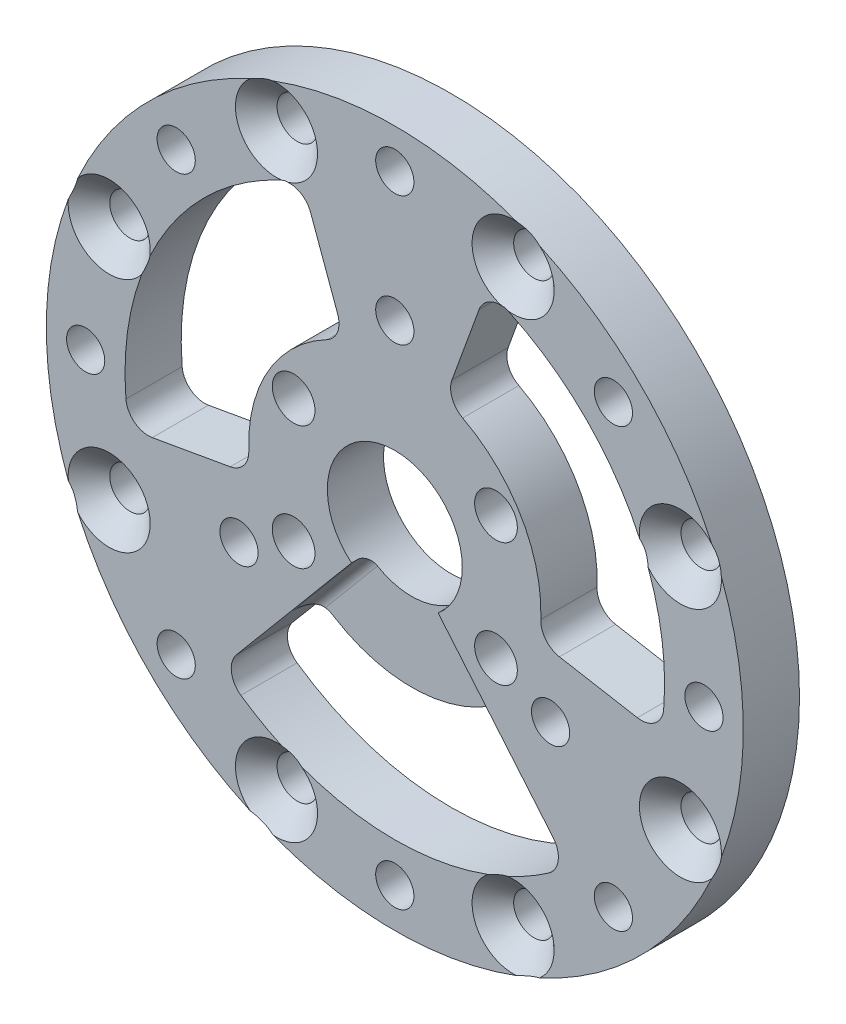
from build123d import *

# Parameters (mm, degrees)
SKETCH_1_R                     = 30.999999999999996
EXTRUDE_1_DEPTH                = 5
SKETCH_2_R                     = 6
CUT_EXTRUDE_1_DEPTH            = 45.12482294582041
HOLE_WIZARD_M3_1_D             = 3.4
HOLE_WIZARD_M3_1_2_D           = 3.6
HOLE_WIZARD_M3_1_2_CSINK_D     = 7.3
HOLE_WIZARD_M3_1_2_CSINK_ANGLE = 90
PATTERN_CIRCULAR_1_COUNT       = 8
HOLE_WIZARD_M3_2_D             = 3.4
PATTERN_CIRCULAR_2_COUNT       = 3
CUT_EXTRUDE_4_DEPTH            = 45.124823097662386
FILLET_1_R                     = 2
PATTERN_CIRCULAR_5_DEPTH       = 5
SKETCH_13_R                    = 1.9
SKETCH_13_R_2                  = 1.8999999999999984
CUT_EXTRUDE_5_DEPTH            = 45.124823097662386
CUT_EXTRUDE_6_DEPTH            = 1.5
FILLET_2_R                     = 1


# Read off the part's stored shape, not the designer's step: 円形ﾊﾟﾀｰﾝ5
with BuildPart() as part:
    # ｽｹｯﾁ1 → ﾎﾞｽ - 押し出し1 (new body)
    with BuildSketch(Plane.XY):
        Circle(SKETCH_1_R)
    extrude(amount=EXTRUDE_1_DEPTH)

    # ｽｹｯﾁ2 → ｶｯﾄ - 押し出し1 (cut, through all)
    with BuildSketch(Plane.XY.offset(5)):
        Circle(SKETCH_2_R)
    extrude(amount=-CUT_EXTRUDE_1_DEPTH, mode=Mode.SUBTRACT)

    # Hole Wizard M3 _1 (through all)
    with Locations(Plane.XY.offset(5)):
        with Locations((0, 27.5)):
            hole_wizard_m3_1 = Hole(HOLE_WIZARD_M3_1_D / 2)

    # Hole Wizard M3 _1 2 (through all)
    with Locations(Plane.XY.offset(5)):
        with Locations((10.52379439, 25.406687144)):
            hole_wizard_m3_1_2 = CounterSinkHole(HOLE_WIZARD_M3_1_2_D / 2, HOLE_WIZARD_M3_1_2_CSINK_D / 2, counter_sink_angle=HOLE_WIZARD_M3_1_2_CSINK_ANGLE)

    # 円形ﾊﾟﾀｰﾝ1: Hole Wizard M3 _1, Hole Wizard M3 _1 2 ×8 about axis
    pattern_circular_1_axis = Axis((-2.28e-14, 6.09e-15, 0), (0, 0, 1))
    add([hole_wizard_m3_1.rotate(pattern_circular_1_axis, i * 360 / PATTERN_CIRCULAR_1_COUNT) for i in range(1, PATTERN_CIRCULAR_1_COUNT)], mode=Mode.SUBTRACT)
    add([hole_wizard_m3_1_2.rotate(pattern_circular_1_axis, i * 360 / PATTERN_CIRCULAR_1_COUNT) for i in range(1, PATTERN_CIRCULAR_1_COUNT)], mode=Mode.SUBTRACT)

    # M3 すきま穴2 (through all)
    with Locations(Plane.XY.offset(5)):
        with Locations((0, 16)):
            hole_wizard_m3_2 = Hole(HOLE_WIZARD_M3_2_D / 2)

    # 円形ﾊﾟﾀｰﾝ2: M3 すきま穴2 ×3 about axis
    pattern_circular_2_axis = Axis((6.2e-16, -9.3e-16, 0), (0, 0, 1))
    for i in range(1, PATTERN_CIRCULAR_2_COUNT):
        add(hole_wizard_m3_2.rotate(pattern_circular_2_axis, i * 360 / PATTERN_CIRCULAR_2_COUNT), mode=Mode.SUBTRACT)

    # ｽｹｯﾁ12 → ｶｯﾄ - 押し出し4 (cut, through all)
    with BuildSketch(Plane.XY.offset(5)):
        with BuildLine():
            Line((-8.356238925925028, -9.958577760546698), (-15.42690263247697, -18.38506663485545))
            ThreePointArc((-15.42690263247697, -18.38506663485545), (1.036e-14, -23.999999999999986), (15.426902632476974, -18.38506663485544))
            Line((15.426902632476974, -18.38506663485544), (8.356238925925028, -9.958577760546694))
            ThreePointArc((8.356238925925028, -9.958577760546694), (8e-16, -12.999999999999998), (-8.356238925925028, -9.958577760546698))
        make_face()
    extrude(amount=-CUT_EXTRUDE_4_DEPTH, mode=Mode.SUBTRACT)

    # ﾌｨﾚｯﾄ1
    fillet_1_edges = [part.edges().sort_by_distance(p)[0] for p in [
        (15.426902632476974, -18.38506663485544, 2.5),
        (-15.42690263247697, -18.38506663485545, 2.5),
        (-8.35623892592503, -9.9585777605467, 2.5),
        (8.35623892592503, -9.958577760546696, 2.5),
    ]]
    fillet(fillet_1_edges, radius=FILLET_1_R)

    # 円形ﾊﾟﾀｰﾝ5 outline → 円形ﾊﾟﾀｰﾝ5 (cut)
    with BuildSketch(Plane.XY):
        with BuildLine():
            ThreePointArc((21.576056845, -3.804440959), (23.143863501, -3.419235313), (23.91638531, -2.001627767))
            ThreePointArc((23.91638531, -2.001627767), (20.784609691, 12), (10.22473216, 21.713011128))
            ThreePointArc((10.22473216, 21.713011128), (8.610787108, 21.752791391), (7.493285905, 20.587633821))
            Line((7.493285905, 20.587633821), (5.084494964, 13.969535102))
            ThreePointArc((5.084494964, 13.969535102), (5.098839949, 12.563258813), (6.035362845, 11.514095507))
            ThreePointArc((6.035362845, 11.514095507), (11.258330249, 6.5), (12.989180633, -0.530270209))
            ThreePointArc((12.989180633, -0.530270209), (13.429521261, -1.865904481), (14.640219759, -2.581465747))
            Line((14.640219759, -2.581465747), (21.576056845, -3.804440959))
        make_face()
        with BuildLine():
            ThreePointArc((-7.493285905, 20.587633821), (-8.610787108, 21.752791391), (-10.22473216, 21.713011128))
            ThreePointArc((-10.22473216, 21.713011128), (-20.784609691, 12), (-23.91638531, -2.001627767))
            ThreePointArc((-23.91638531, -2.001627767), (-23.143863501, -3.419235313), (-21.576056845, -3.804440959))
            Line((-21.576056845, -3.804440959), (-14.640219759, -2.581465747))
            ThreePointArc((-14.640219759, -2.581465747), (-13.429521261, -1.865904481), (-12.989180633, -0.530270209))
            ThreePointArc((-12.989180633, -0.530270209), (-11.258330249, 6.5), (-6.035362845, 11.514095507))
            ThreePointArc((-6.035362845, 11.514095507), (-5.098839949, 12.563258813), (-5.084494964, 13.969535102))
            Line((-5.084494964, 13.969535102), (-7.493285905, 20.587633821))
        make_face()
    extrude(amount=PATTERN_CIRCULAR_5_DEPTH, mode=Mode.SUBTRACT)

    # ｽｹｯﾁ13 → ｶｯﾄ - 押し出し5 (cut, through all)
    with BuildSketch(Plane.XY.offset(5)):
        with Locations((-8.999999999999998, 5.499999999999997)):
            Circle(SKETCH_13_R)
        with Locations((9.000000000000002, 5.499999999999997)):
            Circle(SKETCH_13_R_2)
        with Locations((-8.999999999999998, -5.500000000000003)):
            Circle(SKETCH_13_R)
        with Locations((9.000000000000002, -5.500000000000003)):
            Circle(SKETCH_13_R_2)
    extrude(amount=-CUT_EXTRUDE_5_DEPTH, mode=Mode.SUBTRACT)

    # ｽｹｯﾁ14 → ｶｯﾄ - 押し出し6 (cut)
    with BuildSketch(Plane.XY.offset(5)):
        with BuildLine():
            Line((-9.555724795524648, -11.388069354908032), (-3.8567256581192475, -4.596266658713859))
            ThreePointArc((-3.8567256581192475, -4.596266658713859), (3.7e-16, -6.000000000000001), (3.8567256581192484, -4.59626665871386))
            Line((3.8567256581192484, -4.59626665871386), (9.55572479552465, -11.38806935490803))
            ThreePointArc((9.55572479552465, -11.38806935490803), (9.1e-16, -14.866068747318506), (-9.555724795524648, -11.388069354908032))
        make_face()
    extrude(amount=-CUT_EXTRUDE_6_DEPTH, mode=Mode.SUBTRACT)

    # ﾌｨﾚｯﾄ2
    fillet_2_edges = [part.edges().sort_by_distance(p)[0] for p in [
        (-6.706225226821948, -7.992168006810946, 3.5),
        (6.7062252268219495, -7.992168006810945, 3.5),
    ]]
    fillet(fillet_2_edges, radius=FILLET_2_R)


solid = part.part
